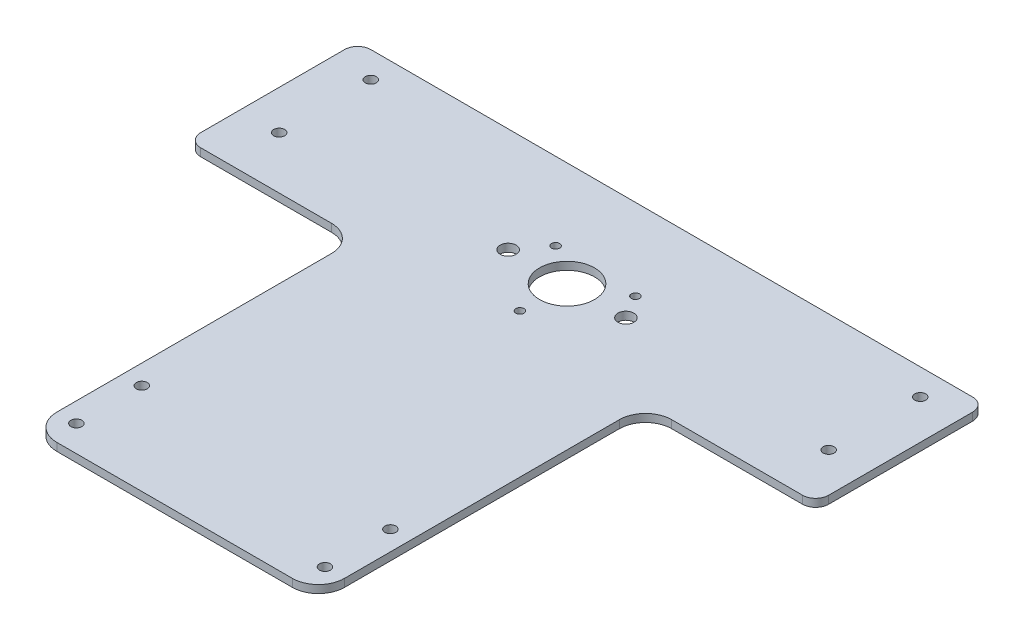
from build123d import *

# Parameters (mm, degrees)
SKETCH_1_R          = 2.1
EXTRUDE_1_DEPTH     = 3
FILLET_1_R          = 5
SKETCH_5_R          = 2.1
CUT_EXTRUDE_4_DEPTH = 10
FILLET_2_R          = 10
SKETCH_3_R          = 10.5
SKETCH_3_R_2        = 1.55
SKETCH_3_R_3        = 3.05
CUT_EXTRUDE_5_DEPTH = 10


with BuildPart() as part:
    # 草图1 → 凸台-拉伸1 (new body)
    with BuildSketch(Plane(origin=(0, 0, 0), x_dir=(1, 0, 0), z_dir=(0, 1, 0))):
        Polygon((-120, 55.625), (-120, -9.375), (-55, -9.375), (-55, -134.375), (55, -134.375), (55, -9.375), (120, -9.375), (120, 55.625), align=None)
        with Locations((-105, 10.625)):
            Circle(SKETCH_1_R, mode=Mode.SUBTRACT)
        with Locations((-105, 45.625)):
            Circle(SKETCH_1_R, mode=Mode.SUBTRACT)
        with Locations((105, 10.625)):
            Circle(SKETCH_1_R, mode=Mode.SUBTRACT)
        with Locations((105, 45.625)):
            Circle(SKETCH_1_R, mode=Mode.SUBTRACT)
    extrude(amount=EXTRUDE_1_DEPTH)

    # 圆角1
    fillet_1_edges = [part.edges().sort_by_distance(p)[0] for p in [
        (120, 1.5, 9.375),
        (-120, 1.5, 9.375),
        (-120, 1.5, -55.625),
        (120, 1.5, -55.625),
    ]]
    fillet(fillet_1_edges, radius=FILLET_1_R)

    # 草图5 → 切除-拉伸4 (cut)
    with BuildSketch(Plane(origin=(0, 3, 0), x_dir=(1, 0, 0), z_dir=(0, 1, 0))):
        with Locations((-47.5, -124.375)):
            Circle(SKETCH_5_R)
        with Locations((47.5, -124.375)):
            Circle(SKETCH_5_R)
        with Locations((47.5, -99.375)):
            Circle(SKETCH_5_R)
        with Locations((-47.5, -99.375)):
            Circle(SKETCH_5_R)
    extrude(amount=-CUT_EXTRUDE_4_DEPTH, mode=Mode.SUBTRACT)

    # 圆角2
    fillet_2_edges = [part.edges().sort_by_distance(p)[0] for p in [
        (55, 1.5, 9.375),
        (55, 1.5, 134.375),
        (-55, 1.5, 134.375),
        (-55, 1.5, 9.375),
    ]]
    fillet(fillet_2_edges, radius=FILLET_2_R)

    # 草图3 → 切除-拉伸5 (cut)
    with BuildSketch(Plane(origin=(0, 3, 0), x_dir=(1, 0, 0), z_dir=(0, 1, 0))):
        with Locations((0, 15.625)):
            Circle(SKETCH_3_R)
        with Locations((0, -2.375)):
            Circle(SKETCH_3_R_2)
        with Locations((-14.721070596, 25.983092513)):
            Circle(SKETCH_3_R_2)
        with Locations((17.198293221, 24.552867364)):
            Circle(SKETCH_3_R_2)
        with Locations((-22.5, 15.625)):
            Circle(SKETCH_3_R_3)
        with Locations((22.5, 15.625)):
            Circle(SKETCH_3_R_3)
    extrude(amount=-CUT_EXTRUDE_5_DEPTH, mode=Mode.SUBTRACT)


solid = part.part
